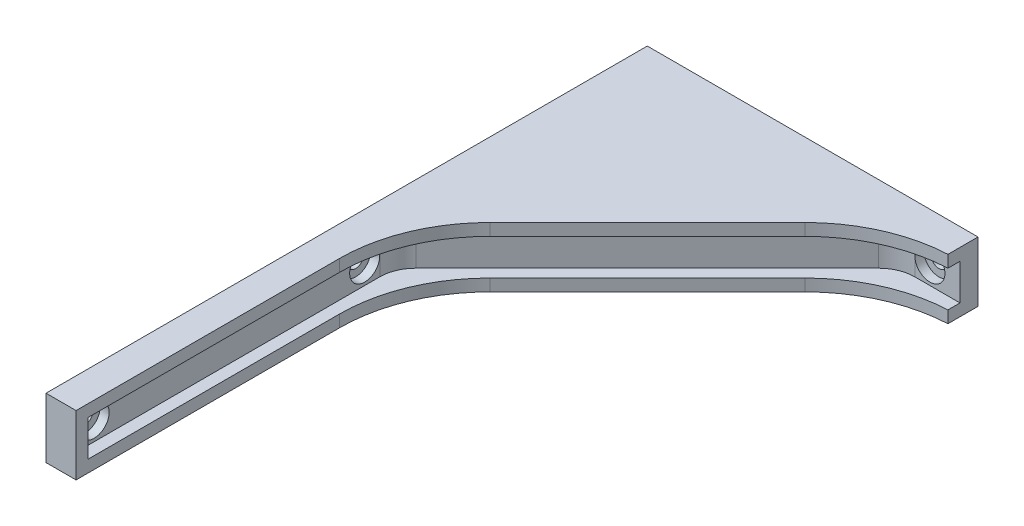
from build123d import *

# Parameters (mm, degrees)
EXTRUDE_1_DEPTH     = 20
CUT_EXTRUDE_1_DEPTH = 20
SKETCH_3_R          = 5
CUT_EXTRUDE_2_DEPTH = 3
CUT_EXTRUDE_3_DEPTH = 6
SKETCH_5_R          = 5
CUT_EXTRUDE_4_DEPTH = 3
SKETCH_6_W          = 90
SKETCH_6_H          = 20
EXTRUDE_2_DEPTH     = 6
SKETCH_7_R          = 5
CUT_EXTRUDE_5_DEPTH = 3
SKETCH_8_R          = 2.6
CUT_EXTRUDE_6_DEPTH = 3
SKETCH_11_W         = 118.79393924
SKETCH_11_H         = 4
EXTRUDE_4_DEPTH     = 4
SKETCH_12_W         = 110
SKETCH_12_H         = 4
EXTRUDE_5_DEPTH     = 4
SKETCH_13_W         = 20
SKETCH_13_H         = 4
EXTRUDE_6_DEPTH     = 4
FILLET_2_R          = 12
FILLET_3_R          = 50
SKETCH_14_W         = 4
SKETCH_14_H         = 12
EXTRUDE_7_DEPTH     = 4


with BuildPart() as part:
    # 草图1 → 凸台-拉伸1 (new body)
    with BuildSketch(Plane(origin=(0, 0, 0), x_dir=(1, 0, 0), z_dir=(0, 1, 0))):
        Polygon((0, 0), (110, 0), (110, -6), (90, -6), (6, -90), (6, -110), (0, -110), align=None)
    extrude(amount=EXTRUDE_1_DEPTH)

    # 草图2 → 切除-拉伸1 (cut)
    with BuildSketch(Plane(origin=(6, 0, 0), x_dir=(0, 0, -1), z_dir=(1, 0, 0))):
        with BuildLine():
            ThreePointArc((-97.4, 10), (-99.005023076, 12.402086785), (-101.838477631, 11.838477631))
            Line((-101.838477631, 11.838477631), (-98.161522369, 8.161522369))
            ThreePointArc((-98.161522369, 8.161522369), (-97.597913215, 9.005023076), (-97.4, 10))
        make_face()
        with BuildLine():
            Line((-98.161522369, 8.161522369), (-101.838477631, 11.838477631))
            ThreePointArc((-101.838477631, 11.838477631), (-101.838477631, 8.161522369), (-98.161522369, 8.161522369))
        make_face()
    extrude(amount=-CUT_EXTRUDE_1_DEPTH, mode=Mode.SUBTRACT)

    # 草图3 → 切除-拉伸2 (cut)
    with BuildSketch(Plane(origin=(6, 0, 0), x_dir=(0, 0, -1), z_dir=(1, 0, 0))):
        with Locations((-100, 10)):
            Circle(SKETCH_3_R)
    extrude(amount=-CUT_EXTRUDE_2_DEPTH, mode=Mode.SUBTRACT)

    # 草图4 → 切除-拉伸3 (cut)
    with BuildSketch(Plane.XY.offset(6)):
        with BuildLine():
            ThreePointArc((102.6, 10), (100.994976924, 12.402086785), (98.161522369, 11.838477631))
            Line((98.161522369, 11.838477631), (101.838477631, 8.161522369))
            ThreePointArc((101.838477631, 8.161522369), (102.402086785, 9.005023076), (102.6, 10))
        make_face()
        with BuildLine():
            Line((101.838477631, 8.161522369), (98.161522369, 11.838477631))
            ThreePointArc((98.161522369, 11.838477631), (98.161522369, 8.161522369), (101.838477631, 8.161522369))
        make_face()
    extrude(amount=-CUT_EXTRUDE_3_DEPTH, mode=Mode.SUBTRACT)

    # 草图5 → 切除-拉伸4 (cut)
    with BuildSketch(Plane.XY.offset(6)):
        with Locations((100, 10)):
            Circle(SKETCH_5_R)
    extrude(amount=-CUT_EXTRUDE_4_DEPTH, mode=Mode.SUBTRACT)

    # 草图6 → 凸台-拉伸2 (add)
    with BuildSketch(Plane.ZY):
        with Locations((155, 10)):
            Rectangle(SKETCH_6_W, SKETCH_6_H)
    extrude(amount=-EXTRUDE_2_DEPTH)

    # 草图7 → 切除-拉伸5 (cut)
    with BuildSketch(Plane(origin=(6, 0, 0), x_dir=(0, 0, -1), z_dir=(1, 0, 0))):
        with Locations((-190, 10)):
            Circle(SKETCH_7_R)
    extrude(amount=-CUT_EXTRUDE_5_DEPTH, mode=Mode.SUBTRACT)

    # 草图8 → 切除-拉伸6 (cut)
    with BuildSketch(Plane(origin=(3, 0, 0), x_dir=(0, 0, -1), z_dir=(1, 0, 0))):
        with Locations((-190, 10)):
            Circle(SKETCH_8_R)
    extrude(amount=-CUT_EXTRUDE_6_DEPTH, mode=Mode.SUBTRACT)

    # 草图11 → 凸台-拉伸4 (add)
    with BuildSketch(Plane(origin=(48, 0, 48), x_dir=(0.7071067811865475, 0, -0.7071067811865476), z_dir=(0.7071067811865476, 0, 0.7071067811865475))):
        with Locations((0, 18)):
            Rectangle(SKETCH_11_W, SKETCH_11_H)
        with Locations((0, 2)):
            Rectangle(SKETCH_11_W, SKETCH_11_H)
    extrude(amount=EXTRUDE_4_DEPTH)

    # 草图12 → 凸台-拉伸5 (add)
    with BuildSketch(Plane(origin=(6, 0, 0), x_dir=(0, 0, -1), z_dir=(1, 0, 0))):
        with Locations((-145, 18)):
            Rectangle(SKETCH_12_W, SKETCH_12_H)
        with Locations((-145, 2)):
            Rectangle(SKETCH_12_W, SKETCH_12_H)
    extrude(amount=EXTRUDE_5_DEPTH)

    # 草图13 → 凸台-拉伸6 (add)
    with BuildSketch(Plane.XY.offset(6)):
        with Locations((100, 18)):
            Rectangle(SKETCH_13_W, SKETCH_13_H)
        with Locations((100, 2)):
            Rectangle(SKETCH_13_W, SKETCH_13_H)
    extrude(amount=EXTRUDE_6_DEPTH)

    # 圆角2
    fillet_2_edges = [part.edges().sort_by_distance(p)[0] for p in [
        (90, 10, 6),
        (6, 10, 90),
    ]]
    fillet(fillet_2_edges, radius=FILLET_2_R)

    # 圆角3
    # the kernel refuses this fillet: 50 mm, written as the material it adds along each edge
    with BuildSketch(Plane(origin=(10, 0, 91.656854249), x_dir=(0, 0, 1), z_dir=(0, 1, 0))) as fillet_3_piece_1:
        with BuildLine():
            CenterArc((FILLET_3_R * 0.414213562373, FILLET_3_R), FILLET_3_R, 225, 45)
            Line((-FILLET_3_R * 0.292893218813, FILLET_3_R * 0.292893218813), (-FILLET_3_R * 0.307035354437, FILLET_3_R * 0.27875108319))
            Line((-FILLET_3_R * 0.307035354437, FILLET_3_R * 0.27875108319), (-FILLET_3_R * 0.00828427124746, -FILLET_3_R * 0.02))
            Line((-FILLET_3_R * 0.00828427124746, -FILLET_3_R * 0.02), (FILLET_3_R * 0.414213562373, -FILLET_3_R * 0.02))
            Line((FILLET_3_R * 0.414213562373, -FILLET_3_R * 0.02), (FILLET_3_R * 0.414213562373, 0))
        make_face()
    extrude(amount=4)
    with BuildSketch(Plane(origin=(10, 0, 91.656854249), x_dir=(0, 0, 1), z_dir=(0, 1, 0))) as fillet_3_piece_2_section:
        with BuildLine():
            CenterArc((FILLET_3_R * 0.414213562373, FILLET_3_R), FILLET_3_R, 225, 45)
            Line((-FILLET_3_R * 0.292893218813, FILLET_3_R * 0.292893218813), (-FILLET_3_R * 0.307035354437, FILLET_3_R * 0.27875108319))
            Line((-FILLET_3_R * 0.307035354437, FILLET_3_R * 0.27875108319), (-FILLET_3_R * 0.00828427124746, -FILLET_3_R * 0.02))
            Line((-FILLET_3_R * 0.00828427124746, -FILLET_3_R * 0.02), (FILLET_3_R * 0.414213562373, -FILLET_3_R * 0.02))
            Line((FILLET_3_R * 0.414213562373, -FILLET_3_R * 0.02), (FILLET_3_R * 0.414213562373, 0))
        make_face()
    fillet_3_piece_2 = extrude(amount=55.776695297, mode=Mode.PRIVATE)
    fillet_3_piece_2 = split(fillet_3_piece_2, bisect_by=Plane(origin=(13.090507107, 16, 92.936984208), z_dir=(0, 1, 0)), keep=Keep.TOP, mode=Mode.PRIVATE)
    fillet_3_piece_2 = split(fillet_3_piece_2, bisect_by=Plane(origin=(13.090507107, 20, 92.936984208), z_dir=(0, -1, 0)), keep=Keep.TOP, mode=Mode.PRIVATE)
    add(fillet_3_piece_2)
    with BuildSketch(Plane(origin=(10, 20, 91.656854249), x_dir=(0, 0, 1), z_dir=(0, -1, 0))) as fillet_3_piece_3:
        with BuildLine():
            CenterArc((FILLET_3_R * 0.414213562373, -FILLET_3_R), FILLET_3_R, 90, 45)
            Line((-FILLET_3_R * 0.292893218813, -FILLET_3_R * 0.292893218813), (-FILLET_3_R * 0.307035354437, -FILLET_3_R * 0.27875108319))
            Line((-FILLET_3_R * 0.307035354437, -FILLET_3_R * 0.27875108319), (-FILLET_3_R * 0.00828427124746, FILLET_3_R * 0.02))
            Line((-FILLET_3_R * 0.00828427124746, FILLET_3_R * 0.02), (FILLET_3_R * 0.414213562373, FILLET_3_R * 0.02))
            Line((FILLET_3_R * 0.414213562373, FILLET_3_R * 0.02), (FILLET_3_R * 0.414213562373, 0))
        make_face()
    extrude(amount=4)
    with BuildSketch(Plane(origin=(10, 20, 91.656854249), x_dir=(0, 0, 1), z_dir=(0, -1, 0))) as fillet_3_piece_4_section:
        with BuildLine():
            CenterArc((FILLET_3_R * 0.414213562373, -FILLET_3_R), FILLET_3_R, 90, 45)
            Line((-FILLET_3_R * 0.292893218813, -FILLET_3_R * 0.292893218813), (-FILLET_3_R * 0.307035354437, -FILLET_3_R * 0.27875108319))
            Line((-FILLET_3_R * 0.307035354437, -FILLET_3_R * 0.27875108319), (-FILLET_3_R * 0.00828427124746, FILLET_3_R * 0.02))
            Line((-FILLET_3_R * 0.00828427124746, FILLET_3_R * 0.02), (FILLET_3_R * 0.414213562373, FILLET_3_R * 0.02))
            Line((FILLET_3_R * 0.414213562373, FILLET_3_R * 0.02), (FILLET_3_R * 0.414213562373, 0))
        make_face()
    fillet_3_piece_4 = extrude(amount=55.776695297, mode=Mode.PRIVATE)
    fillet_3_piece_4 = split(fillet_3_piece_4, bisect_by=Plane(origin=(13.090507107, 4, 92.936984208), z_dir=(0, -1, 0)), keep=Keep.TOP, mode=Mode.PRIVATE)
    fillet_3_piece_4 = split(fillet_3_piece_4, bisect_by=Plane(origin=(13.090507107, 0, 92.936984208), z_dir=(0, 1, 0)), keep=Keep.TOP, mode=Mode.PRIVATE)
    add(fillet_3_piece_4)
    with BuildSketch(Plane(origin=(91.656854249, 0, 10), x_dir=(1, 0, 0), z_dir=(0, 1, 0))) as fillet_3_piece_5:
        with BuildLine():
            CenterArc((20.769589097, -49.941089022), FILLET_3_R, 92.781591787, 42.218408213)
            Line((-14.585749963, -14.585749963), (-15.292856744, -13.878643181))
            Line((-15.292856744, -13.878643181), (-0.707106781, 0.707106781))
            Line((-0.707106781, 0.707106781), (0, 1))
            ThreePointArc((0, 1), (9.171572875, 1), (18.294616884, 0.99882178))
            Line((18.294616884, 0.99882178), (18.343145751, 0))
        make_face()
    extrude(amount=4)
    with BuildSketch(Plane(origin=(91.656854249, 0, 10), x_dir=(1, 0, 0), z_dir=(0, 1, 0))) as fillet_3_piece_6_section:
        with BuildLine():
            CenterArc((20.769589097, -49.941089022), FILLET_3_R, 92.781591787, 42.218408213)
            Line((-14.585749963, -14.585749963), (-15.292856744, -13.878643181))
            Line((-15.292856744, -13.878643181), (-0.707106781, 0.707106781))
            Line((-0.707106781, 0.707106781), (0, 1))
            ThreePointArc((0, 1), (9.171572875, 1), (18.294616884, 0.99882178))
            Line((18.294616884, 0.99882178), (18.343145751, 0))
        make_face()
    fillet_3_piece_6 = extrude(amount=55.568413536, mode=Mode.PRIVATE)
    fillet_3_piece_6 = split(fillet_3_piece_6, bisect_by=Plane(origin=(92.410386276, 16, 13.180383565), z_dir=(0, 1, 0)), keep=Keep.TOP, mode=Mode.PRIVATE)
    fillet_3_piece_6 = split(fillet_3_piece_6, bisect_by=Plane(origin=(92.410386276, 20, 13.180383565), z_dir=(0, -1, 0)), keep=Keep.TOP, mode=Mode.PRIVATE)
    add(fillet_3_piece_6)
    with BuildSketch(Plane(origin=(91.656854249, 20, 10), x_dir=(1, 0, 0), z_dir=(0, -1, 0))) as fillet_3_piece_7:
        with BuildLine():
            CenterArc((20.769589097, 49.941089022), FILLET_3_R, 225, 42.218408213)
            Line((-14.585749963, 14.585749963), (-15.292856744, 13.878643181))
            Line((-15.292856744, 13.878643181), (-0.707106781, -0.707106781))
            Line((-0.707106781, -0.707106781), (0, -1))
            ThreePointArc((0, -1), (9.171572875, -1), (18.294616884, -0.99882178))
            Line((18.294616884, -0.99882178), (18.343145751, 0))
        make_face()
    extrude(amount=4)
    with BuildSketch(Plane(origin=(91.656854249, 20, 10), x_dir=(1, 0, 0), z_dir=(0, -1, 0))) as fillet_3_piece_8_section:
        with BuildLine():
            CenterArc((20.769589097, 49.941089022), FILLET_3_R, 225, 42.218408213)
            Line((-14.585749963, 14.585749963), (-15.292856744, 13.878643181))
            Line((-15.292856744, 13.878643181), (-0.707106781, -0.707106781))
            Line((-0.707106781, -0.707106781), (0, -1))
            ThreePointArc((0, -1), (9.171572875, -1), (18.294616884, -0.99882178))
            Line((18.294616884, -0.99882178), (18.343145751, 0))
        make_face()
    fillet_3_piece_8 = extrude(amount=55.568413536, mode=Mode.PRIVATE)
    fillet_3_piece_8 = split(fillet_3_piece_8, bisect_by=Plane(origin=(92.410386276, 4, 13.180383565), z_dir=(0, -1, 0)), keep=Keep.TOP, mode=Mode.PRIVATE)
    fillet_3_piece_8 = split(fillet_3_piece_8, bisect_by=Plane(origin=(92.410386276, 0, 13.180383565), z_dir=(0, 1, 0)), keep=Keep.TOP, mode=Mode.PRIVATE)
    add(fillet_3_piece_8)

    # 草图14 → 凸台-拉伸7 (add)
    with BuildSketch(Plane(origin=(6, 0, 0), x_dir=(0, 0, -1), z_dir=(1, 0, 0))):
        with Locations((-198, 10)):
            Rectangle(SKETCH_14_W, SKETCH_14_H)
    extrude(amount=EXTRUDE_7_DEPTH)


solid = part.part
